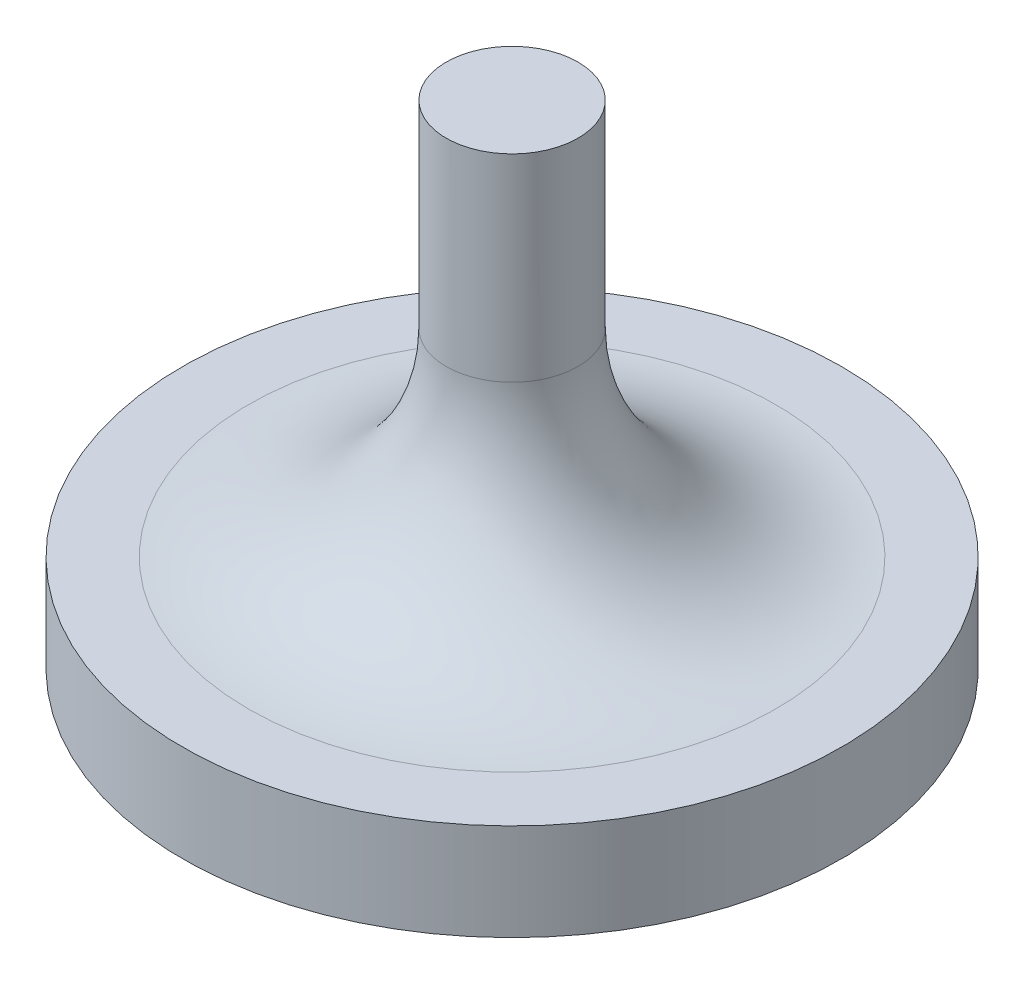
from build123d import *

# Parameters (mm, degrees)
FILLET1_R = 50
FILLET2_R = 15


with BuildPart() as part:
    # Sketch2 → Revolve1 (revolve)
    with BuildSketch(Plane(origin=(0, 0, 0), x_dir=(0, 0, -1), z_dir=(1, 0, 0))):
        Polygon((0, 0), (0, 50), (5, 50), (5, 20), (25, 20), (25, 12.660254038), (5, 12.660254038), (5, 8.660254038), align=None)
    revolve(axis=Axis((0, 0, 0), (0, 1, 0)))

    # Fillet1
    # the kernel refuses this fillet: 50 mm, written as the material it adds along each edge
    with BuildSketch(Plane(origin=(0, 12.660254038, 0), x_dir=(0, 0, -1), z_dir=(1, 0, 0))) as fillet1_piece_1:
        with BuildLine():
            CenterArc((24.595917942, -50), FILLET1_R, 90, 23.073918066)
            Line((5, -4), (5, 0))
            Line((5, 0), (24.595917942, 0))
        make_face()
    revolve(axis=Axis((0, 12.660254038, 0), (0, 1, 0)))

    # Fillet2
    fillet2_edges = [part.edges().sort_by_distance(p)[0] for p in [
        (0, 20, 5),
    ]]
    fillet(fillet2_edges, radius=FILLET2_R)


solid = part.part
